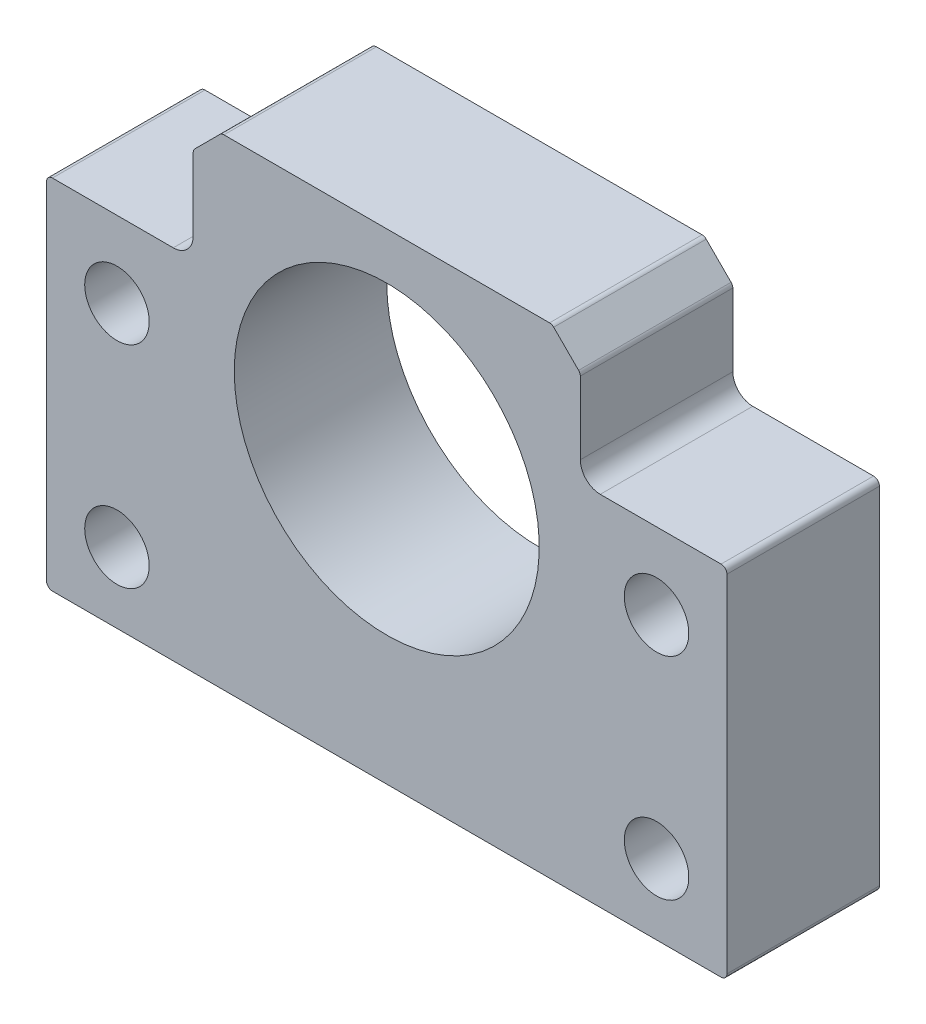
from build123d import *

# Parameters (mm, degrees)
SKETCH1_R           = 2.75
SKETCH1_R_2         = 13
BOSS_EXTRUDE1_DEPTH = 13
FILLET1_R           = 1.7
FILLET2_R           = 0.5


with BuildPart() as part:
    # Sketch1 → Boss-Extrude1 (new body)
    with BuildSketch(Plane.XY):
        Polygon((40.027969698, 14.696983914), (27.527969698, 14.696983914), (27.527969698, 22.782770351), (25.113756136, 25.196983914), (-3.057816739, 25.196983914), (-5.472030302, 22.782770351), (-5.472030302, 14.696983914), (-17.972030302, 14.696983914), (-17.972030302, -15.803016086), (40.027969698, -15.803016086), align=None)
        with Locations((34.027969698, 8.196983914)):
            Circle(SKETCH1_R, mode=Mode.SUBTRACT)
        with Locations((34.027969698, -9.803016086)):
            Circle(SKETCH1_R, mode=Mode.SUBTRACT)
        with Locations((-11.972030302, -9.803016086)):
            Circle(SKETCH1_R, mode=Mode.SUBTRACT)
        with Locations((-11.972030302, 8.196983914)):
            Circle(SKETCH1_R, mode=Mode.SUBTRACT)
        with Locations((11.027969698, 8.196983914)):
            Circle(SKETCH1_R_2, mode=Mode.SUBTRACT)
    extrude(amount=BOSS_EXTRUDE1_DEPTH)

    # Fillet1
    fillet1_edges = [part.edges().sort_by_distance(p)[0] for p in [
        (27.527969698, 14.696983914, 6.5),
        (-5.472030302, 14.696983914, 6.5),
    ]]
    fillet(fillet1_edges, radius=FILLET1_R)

    # Fillet2
    fillet2_edges = [part.edges().sort_by_distance(p)[0] for p in [
        (-17.972030302, 14.696983914, 6.5),
        (-17.972030302, -15.803016086, 6.5),
        (40.027969698, -15.803016086, 6.5),
        (40.027969698, 14.696983914, 6.5),
        (27.527969698, 22.782770351, 6.5),
        (25.113756136, 25.196983914, 6.5),
        (-3.057816739, 25.196983914, 6.5),
        (-5.472030302, 22.782770351, 6.5),
    ]]
    fillet(fillet2_edges, radius=FILLET2_R)


solid = part.part
